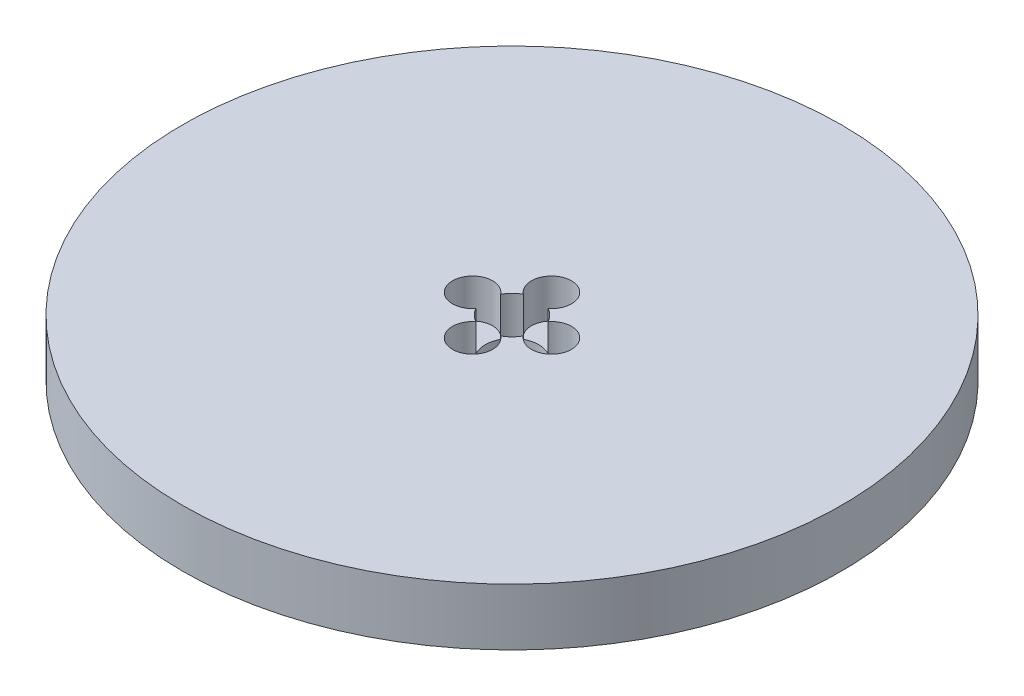
from build123d import *

# Parameters (mm, degrees)
SKETCH1_R           = 92.5
BOSS_EXTRUDE1_DEPTH = 16
SKETCH2_R           = 7.5
CUT_EXTRUDE1_DEPTH  = 132.789605053
SKETCH3_R           = 5.618722683
CUT_EXTRUDE2_DEPTH  = 10.947257965
CIRPATTERN1_COUNT   = 4


with BuildPart() as part:
    # Sketch1 → Boss-Extrude1 (new body)
    with BuildSketch(Plane(origin=(0, 0, 0), x_dir=(1, 0, 0), z_dir=(0, 1, 0))):
        Circle(SKETCH1_R)
    extrude(amount=BOSS_EXTRUDE1_DEPTH)

    # Sketch2 → Cut-Extrude1 (cut, through all)
    with BuildSketch(Plane(origin=(0, 0, 0), x_dir=(1, 0, 0), z_dir=(0, 1, 0))):
        Circle(SKETCH2_R)
    extrude(amount=CUT_EXTRUDE1_DEPTH, mode=Mode.SUBTRACT)

    # Sketch3 → Cut-Extrude2 (cut)
    with BuildSketch(Plane(origin=(0, 16, 0), x_dir=(1, 0, 0), z_dir=(0, 1, 0))):
        with Locations((-11.069779224, 0)):
            Circle(SKETCH3_R)
    cut_extrude2 = extrude(amount=-CUT_EXTRUDE2_DEPTH, mode=Mode.SUBTRACT)

    # CirPattern1: Cut-Extrude2 ×4 about axis
    cirpattern1_axis = Axis((0, 0, 0), (0, 1, 0))
    for i in range(1, CIRPATTERN1_COUNT):
        add(cut_extrude2.rotate(cirpattern1_axis, i * 360 / CIRPATTERN1_COUNT), mode=Mode.SUBTRACT)


solid = part.part
